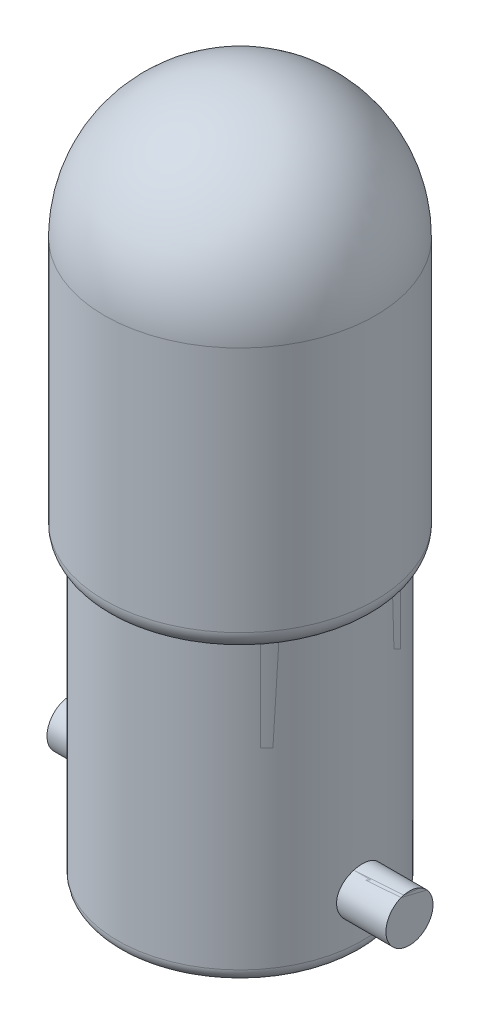
from build123d import *

# Parameters (mm, degrees)
SKETCH2_R           = 0.875
BOSS_EXTRUDE1_DEPTH = 6.3
SWEEP1_START        = -6.3
SWEEP1_OUTLINE_R    = 0.875
SWEEP1_DEPTH        = 12.6
SWEEP1_3_OUTLINE_R  = 0.5
SWEEP1_3_ANGLE      = 180
SWEEP1_START_2      = 12
SWEEP1_4_OUTLINE_R  = 0.5
SWEEP1_4_DEPTH      = 10.2500001
SWEEP1_5_OUTLINE_R  = 0.5
SWEEP1_5_DEPTH      = 10.2500001


with BuildPart() as part:
    # Sketch1 → Revolve1 (revolve)
    with BuildSketch(Plane(origin=(0, 0, 0), x_dir=(0, 0, -1), z_dir=(1, 0, 0))):
        with BuildLine():
            ThreePointArc((1.5, 0.699461487), (0.827533439, 0.183459747), (0, 0))
            Line((0, 0), (0, 12.75))
            Line((0, 12.75), (4.2, 12.75))
            Line((4.2, 12.75), (4.2, 13.5))
            Line((4.2, 13.5), (4.55, 13.5))
            Line((4.55, 13.5), (4.55, 3))
            ThreePointArc((4.55, 3), (4.403553391, 2.646446609), (4.05, 2.5))
            Line((4.05, 2.5), (3.010831202, 2.5))
            Line((3.010831202, 2.5), (1.5, 0.699461487))
        make_face()
    revolve(axis=Axis((0, 0, 0), (0, 1, 0)))

    # Sketch2 → Boss-Extrude1 (add, symmetric)
    with BuildSketch(Plane(origin=(0, 0, 0), x_dir=(0, 0, -1), z_dir=(1, 0, 0))):
        with Locations(Location((0, 4.6, 0), (0, 0, 180))):
            Circle(SKETCH2_R)
    extrude(amount=BOSS_EXTRUDE1_DEPTH, both=True)

    # Sweep1 3 outline → Sweep1 3 (revolve)
    with BuildSketch(Plane(origin=(0, 22.25, 0), x_dir=(0, 0, -1), z_dir=(0, -1, 0))):
        with Locations((2.5, 0)):
            Circle(SWEEP1_3_OUTLINE_R)
    revolve(axis=Axis((0, 22.25, 0), (1, 0, 0)), revolution_arc=SWEEP1_3_ANGLE)

    # Sweep1 4 outline → Sweep1 4 (add)
    with BuildSketch(Plane(origin=(0, 0, 0), x_dir=(1, 0, 0), z_dir=(0, 1, 0)).offset(SWEEP1_START_2)):
        with Locations((0, -2.5)):
            Circle(SWEEP1_4_OUTLINE_R)
    extrude(amount=SWEEP1_4_DEPTH)

    # Sweep1 5 outline → Sweep1 5 (add)
    with BuildSketch(Plane(origin=(0, 0, 0), x_dir=(1, 0, 0), z_dir=(0, 1, 0)).offset(SWEEP1_START_2)):
        with Locations((0, 2.5)):
            Circle(SWEEP1_5_OUTLINE_R)
    extrude(amount=SWEEP1_5_DEPTH)


with BuildPart() as body_2:
    # Sketch1<3> → Revolve2 (revolve)
    with BuildSketch(Plane(origin=(0, 0, 0), x_dir=(0, 0, -1), z_dir=(1, 0, 0))):
        with BuildLine():
            Line((4.2, 13.5), (4.55, 13.5))
            ThreePointArc((4.55, 13.5), (4.901948134, 13.775155065), (5.035, 14.201623118))
            Line((5.035, 14.201623118), (5.035, 23.365))
            ThreePointArc((5.035, 23.365), (3.560282643, 26.925282643), (0, 28.4))
            Line((0, 28.4), (0, 28.3))
            ThreePointArc((0, 28.3), (3.489571965, 26.854571965), (4.935, 23.365))
            Line((4.935, 23.365), (4.935, 14.201623118))
            ThreePointArc((4.935, 14.201623118), (4.799660082, 13.804602968), (4.45, 13.572914124))
            Line((4.45, 13.572914124), (4.072899594, 13.572914124))
            Line((4.072899594, 13.572914124), (4.072899594, 12.75))
            Line((4.072899594, 12.75), (4.2, 12.75))
            Line((4.2, 12.75), (4.2, 13.5))
        make_face()
    revolve(axis=Axis((0, 0, 0), (0, 1, 0)))

    # Sweep1: read off the stored shape, not the designer's step
    # Sweep1 outline → Sweep1 (add)
    with BuildSketch(Plane.YZ.offset(SWEEP1_START)):
        with Locations((4.6, 0)):
            Circle(SWEEP1_OUTLINE_R)
    extrude(amount=SWEEP1_DEPTH)

    # Sweep1 2 outline → Sweep1 2 (revolve)
    with BuildSketch(Plane.XY):
        with BuildLine():
            Line((4.55, 13.5), (4.2, 13.5))
            Line((4.2, 13.5), (4.2, 12.75))
            Line((4.2, 12.75), (0, 12.75))
            Line((0, 12.75), (0, 0))
            ThreePointArc((0, 0), (0.82753344, 0.183459747), (1.500000001, 0.699461489))
            Line((1.500000001, 0.699461489), (3.010831202, 2.5))
            Line((3.010831202, 2.5), (4.05, 2.5))
            ThreePointArc((4.05, 2.5), (4.403553391, 2.646446609), (4.55, 3))
            Line((4.55, 3), (4.55, 13.5))
        make_face()
    revolve(axis=Axis((0, 0, 0), (0, 1, 0)))


solid = Compound([part.part, body_2.part])
